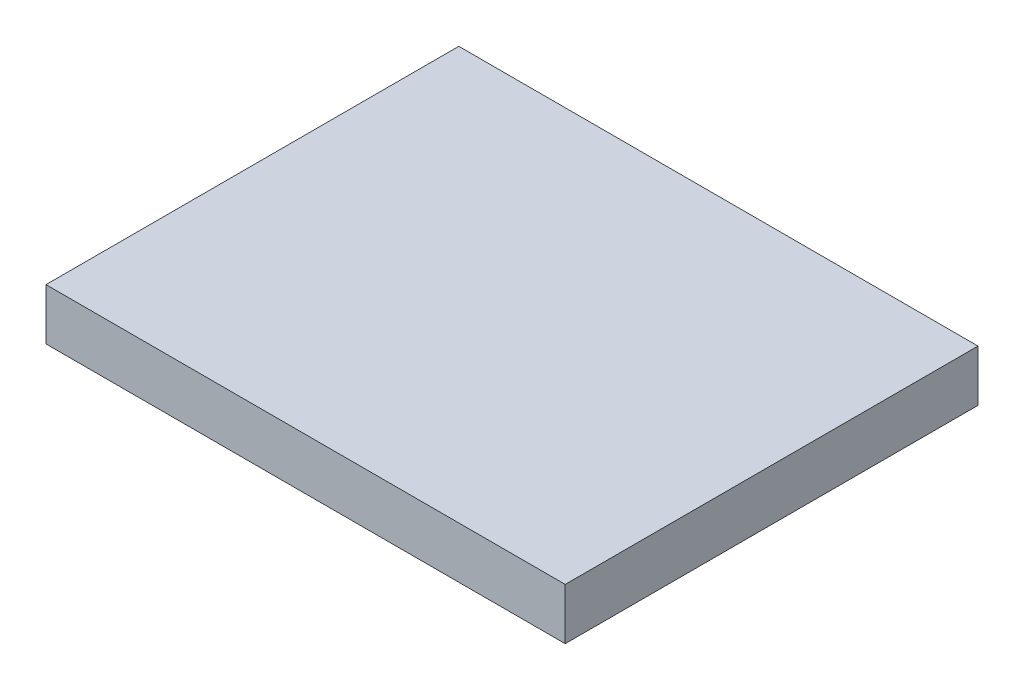
from build123d import *

# Parameters (mm, degrees)
SKETCH1_W           = 283
SKETCH1_H           = 225
BOSS_EXTRUDE1_DEPTH = 28
SKETCH2_R           = 10
BOSS_EXTRUDE2_DEPTH = 6.5


with BuildPart() as part:
    # Sketch1 → Boss-Extrude1 (new body)
    with BuildSketch(Plane(origin=(0, 0, 0), x_dir=(1, 0, 0), z_dir=(0, 1, 0))):
        with Locations((141.5, 112.5)):
            Rectangle(SKETCH1_W, SKETCH1_H)
    extrude(amount=BOSS_EXTRUDE1_DEPTH)

    # Sketch2 → Boss-Extrude2 (add)
    with BuildSketch(Plane.XZ):
        with Locations((25, -25)):
            Circle(SKETCH2_R)
        with Locations((25, -200)):
            Circle(SKETCH2_R)
        with Locations((258, -200)):
            Circle(SKETCH2_R)
        with Locations((258, -25)):
            Circle(SKETCH2_R)
    extrude(amount=BOSS_EXTRUDE2_DEPTH)


solid = part.part
